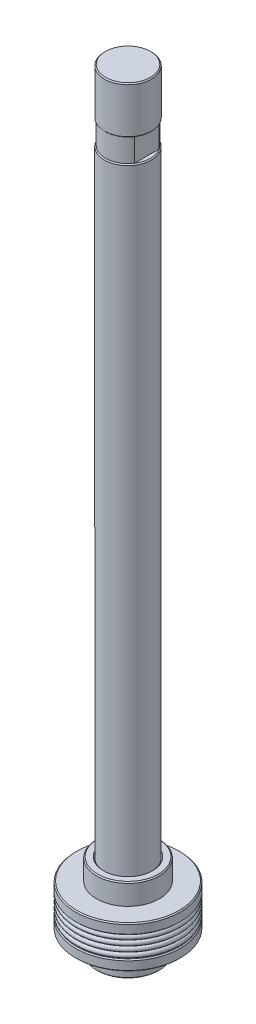
from build123d import *

# Parameters (mm, degrees)
SKETCH_1_R          = 22.5
EXTRUDE_1_DEPTH     = 736
SKETCH_2_W          = 1
SKETCH_2_H          = 22
SKETCH_3_W          = 4.5
SKETCH_3_H          = 22
CUT_EXTRUDE_1_DEPTH = 368
CHAMFER_1_SIZE      = 1
CHAMFER_2_SIZE      = 1
CHAMFER_3_SIZE      = 1
SKETCH_5_W          = 5
SKETCH_5_H          = 20
SKETCH_6_R          = 2.5
CHAMFER_4_SIZE      = 1
CHAMFER_5_SIZE      = 1
CHAMFER_6_SIZE      = 1


with BuildPart() as part:
    # 草圖1 → 填料-伸長1 (new body)
    with BuildSketch(Plane(origin=(0, 0, 0), x_dir=(1, 0, 0), z_dir=(0, 1, 0))):
        with Locations(Location((0, 0, 0), (0, 0, 270))):
            Circle(SKETCH_1_R)
    extrude(amount=EXTRUDE_1_DEPTH)

    # 草圖2 → 除料-旋轉1 (revolve, cut)
    with BuildSketch(Plane.XY):
        with Locations((22, 680)):
            Rectangle(SKETCH_2_W, SKETCH_2_H)
    revolve(axis=Axis((0, -264, 0), (0, 1, 0)), mode=Mode.SUBTRACT)

    # 草圖3 → 除料-伸長1 (cut, symmetric)
    with BuildSketch(Plane.XY):
        with Locations((-20.25, 680)):
            Rectangle(SKETCH_3_W, SKETCH_3_H)
        with Locations((20.25, 680)):
            Rectangle(SKETCH_3_W, SKETCH_3_H)
    extrude(amount=CUT_EXTRUDE_1_DEPTH, both=True, mode=Mode.SUBTRACT)

    # 導角1
    chamfer_1_edges = [part.edges().sort_by_distance(p)[0] for p in [
        (0, 691, -22.5),
        (0, 669, -22.5),
    ]]
    chamfer(chamfer_1_edges, length=CHAMFER_1_SIZE - 0.0001)  # a hair under: the kernel refuses the full size

    # 導角2
    chamfer_2_edges = [part.edges().sort_by_distance(p)[0] for p in [
        (0, 736, -22.5),
    ]]
    chamfer(chamfer_2_edges, length=CHAMFER_2_SIZE)

    # 導角3
    chamfer_3_edges = [part.edges().sort_by_distance(p)[0] for p in [
        (0, 0, -22.5),
    ]]
    chamfer(chamfer_3_edges, length=CHAMFER_3_SIZE)


with BuildPart() as body_2:
    # 草圖4 → 旋轉1 (revolve)
    with BuildSketch(Plane.XY, mode=Mode.PRIVATE) as revolve_1_sk:
        Polygon((-22.5, 80), (-22.5, 0), (-30, 0), (-30, 20), (-50, 20), (-50, 60), (-30, 60), (-30, 80), align=None)
    revolve(revolve_1_sk.sketch.rotate(Axis((0, -1000, 0), (0, 1, 0)), 180), axis=Axis((0, -1000, 0), (0, 1, 0)))

    # 草圖5 → 除料-旋轉2 (revolve, cut)
    with BuildSketch(Plane.XY, mode=Mode.PRIVATE) as cut_revolve_2_sk:
        with Locations((-47.5, 40)):
            Rectangle(SKETCH_5_W, SKETCH_5_H)
    revolve(cut_revolve_2_sk.sketch.rotate(Axis((0, -1000, 0), (0, 1, 0)), 180), axis=Axis((0, -1000, 0), (0, 1, 0)), mode=Mode.SUBTRACT)

    # 導角4
    chamfer_4_edges = [body_2.edges().sort_by_distance(p)[0] for p in [
        (-50, 50, 0),
        (-50, 30, 0),
        (-50, 60, 0),
        (-50, 20, 0),
    ]]
    chamfer(chamfer_4_edges, length=CHAMFER_4_SIZE)

    # 導角5
    chamfer_5_edges = [body_2.edges().sort_by_distance(p)[0] for p in [
        (-22.5, 0, 0),
        (-22.5, 80, 0),
    ]]
    chamfer(chamfer_5_edges, length=CHAMFER_5_SIZE)

    # 導角6
    chamfer_6_edges = [body_2.edges().sort_by_distance(p)[0] for p in [
        (-30, 80, 0),
        (-30, 0, 0),
    ]]
    chamfer(chamfer_6_edges, length=CHAMFER_6_SIZE)


with BuildPart() as body_3:
    # 草圖6 → 旋轉2 (revolve)
    with BuildSketch(Plane.XY, mode=Mode.PRIVATE) as revolve_2_sk:
        with Locations((-47.5, 47.5)):
            Circle(SKETCH_6_R)
        with Locations((-47.5, 42.5)):
            Circle(SKETCH_6_R)
        with Locations((-47.5, 37.5)):
            Circle(SKETCH_6_R)
        with Locations((-47.5, 32.5)):
            Circle(SKETCH_6_R)
    revolve(revolve_2_sk.sketch.rotate(Axis((0, -1000, 0), (0, 1, 0)), 180), axis=Axis((0, -1000, 0), (0, 1, 0)))


with BuildPart() as m12x1_5_1_tool:
    # 草圖9 → M12x1.5 螺紋孔1 (revolve)
    with BuildSketch(Plane(origin=(0, 10, 50), x_dir=(0, -1, 0), z_dir=(1, 0, 0))):
        Polygon((0, 0), (0, 53.15451825), (5.25, 50), (5.25, 0), align=None)
    revolve(axis=Axis((0, 10, 56.35), (0, 0, -1)))


with BuildPart() as part_1:
    add(part.part)

    # M12x1.5 螺紋孔1: cut by m12x1_5_1_tool
    add(m12x1_5_1_tool.part, mode=Mode.SUBTRACT)


with BuildPart() as body_2_1:
    add(body_2.part)

    # M12x1.5 螺紋孔1: cut by m12x1_5_1_tool
    add(m12x1_5_1_tool.part, mode=Mode.SUBTRACT)


solid = Compound([body_3.part, part_1.part, body_2_1.part])
